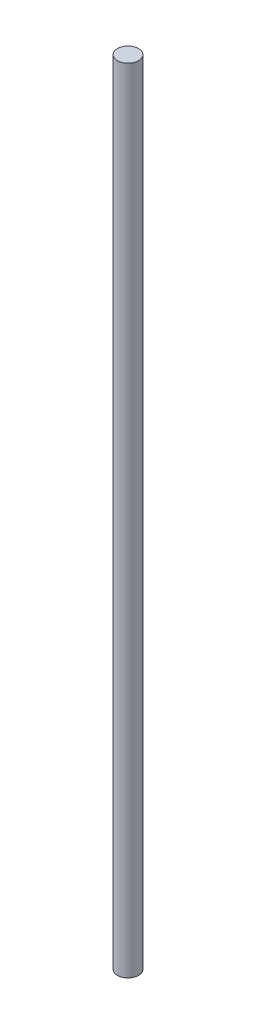
from build123d import *

# Parameters (mm, degrees)
SKETCH1_R           = 4
BOSS_EXTRUDE1_DEPTH = 300


with BuildPart() as part:
    # Sketch1 → Boss-Extrude1 (new body)
    with BuildSketch(Plane(origin=(0, 0, 0), x_dir=(1, 0, 0), z_dir=(0, 1, 0))):
        with Locations((-37.352591343, 21.809093655)):
            Circle(SKETCH1_R)
    extrude(amount=BOSS_EXTRUDE1_DEPTH)


solid = part.part
